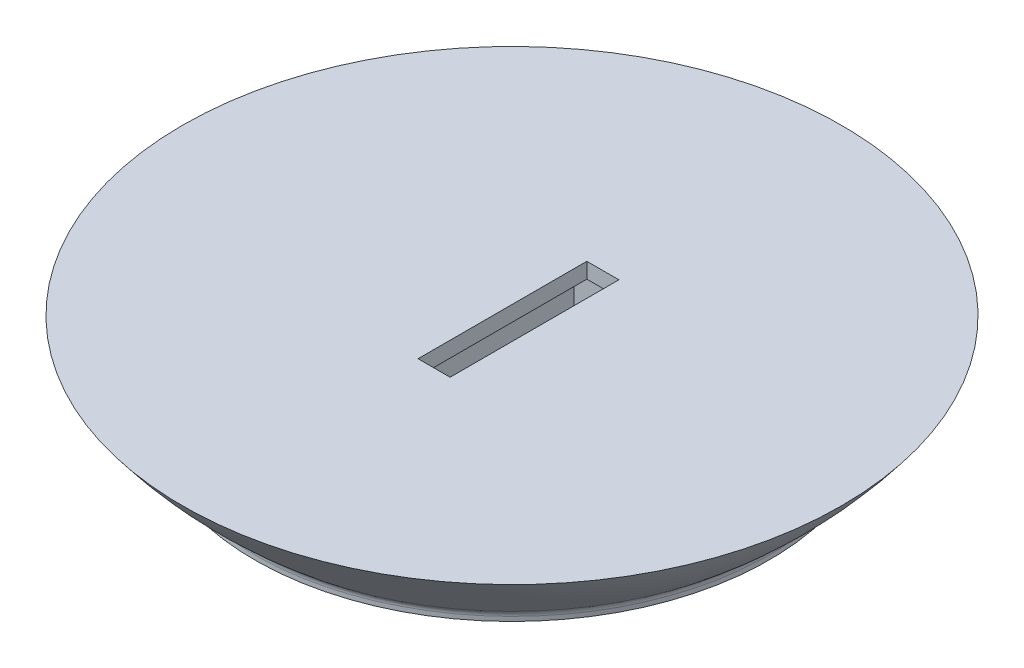
from build123d import *

# Parameters (mm, degrees)
SKETCH2_W          = 5.7
SKETCH2_H          = 30
CUT_EXTRUDE3_DEPTH = 85.139032173
SKETCH5_W          = 11
SKETCH5_H          = 34
CUT_EXTRUDE6_DEPTH = 12


with BuildPart() as part:
    # Sketch1 → Revolve2 (revolve)
    with BuildSketch(Plane.XY):
        with BuildLine():
            Line((-45.75, -58.609702547), (0, -58.609702547))
            Line((0, -58.609702547), (0, -43.859702547))
            Line((0, -43.859702547), (-58.573945722, -43.859702547))
            ThreePointArc((-58.573945722, -43.859702547), (-52.826793659, -50.635071805), (-46.300887178, -56.663996255))
            ThreePointArc((-46.300887178, -56.663996255), (-45.894701281, -57.182761001), (-45.75, -57.825540421))
            Line((-45.75, -57.825540421), (-45.75, -58.609702547))
        make_face()
    revolve(axis=Axis((0, -43.859702547, 0), (0, -1, 0)))

    # Sketch2 → Cut-Extrude3 (cut, through all)
    with BuildSketch(Plane(origin=(0, -43.859702547, 0), x_dir=(1, 0, 0), z_dir=(0, 1, 0))):
        with Locations((1.15, 0)):
            Rectangle(SKETCH2_W, SKETCH2_H)
    extrude(amount=-CUT_EXTRUDE3_DEPTH, mode=Mode.SUBTRACT)

    # Sketch5 → Cut-Extrude6 (cut)
    with BuildSketch(Plane.XZ.offset(58.609702547)):
        with Locations((-0.5, 0)):
            Rectangle(SKETCH5_W, SKETCH5_H)
    extrude(amount=-CUT_EXTRUDE6_DEPTH, mode=Mode.SUBTRACT)


solid = part.part
